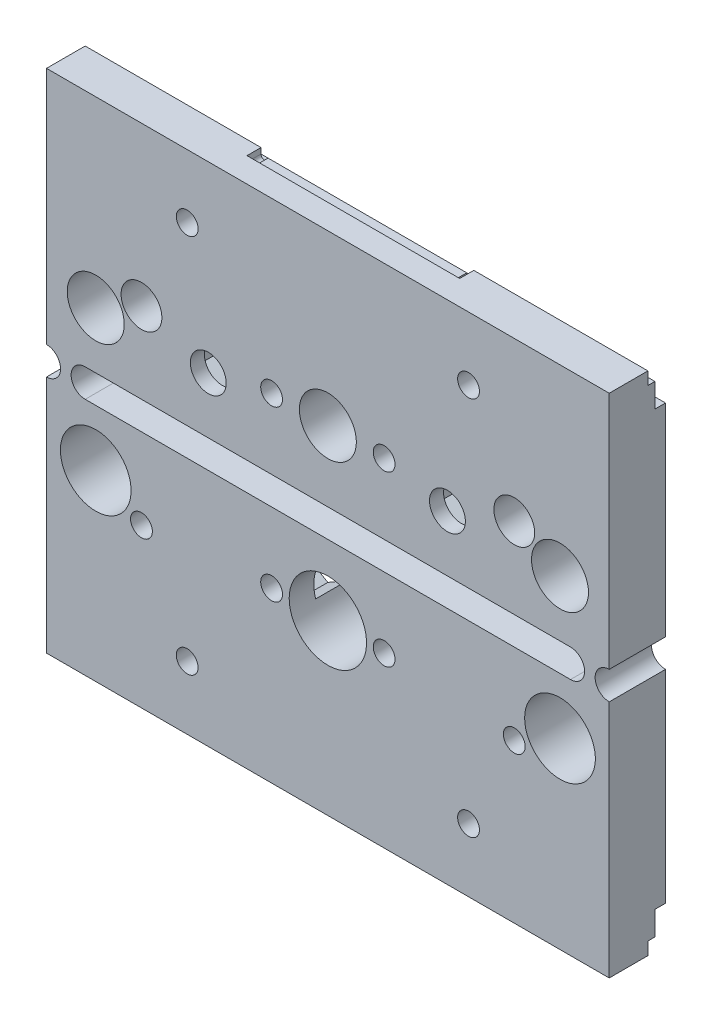
from build123d import *

# Parameters (mm, degrees)
SKETCH_2_W           = 80
SKETCH_2_H           = 34
SKETCH_2_R           = 4.05
EXTRUDE_1_DEPTH      = 8
SKETCH_3_R           = 2.55
CUT_EXTRUDE_1_DEPTH  = 88.292611371
CUT_EXTRUDE_2_DEPTH  = 88.292611371
SKETCH_5_R           = 1.55
CUT_EXTRUDE_3_DEPTH  = 88.292611371
CUT_EXTRUDE_5_DEPTH  = 4.5
SKETCH_25_R          = 1.55
CUT_EXTRUDE_13_DEPTH = 88.292611371
CUT_EXTRUDE_11_DEPTH = 2
EXTRUDE_2_DEPTH      = 8
SKETCH_26_R          = 5.025
CUT_EXTRUDE_14_DEPTH = 89.926936302
SKETCH_27_R          = 2.9
SKETCH_27_R_2        = 1.55
CUT_EXTRUDE_15_DEPTH = 89.926936302
CUT_EXTRUDE_16_DEPTH = 6
SKETCH_29_R          = 5.5
CUT_EXTRUDE_17_DEPTH = 89.926936302


with BuildPart() as part:
    # 草图2 → 凸台-拉伸1 (new body)
    with BuildSketch(Plane.XY):
        with Locations((40, 17)):
            Rectangle(SKETCH_2_W, SKETCH_2_H)
        with Locations((7, 8)):
            Circle(SKETCH_2_R, mode=Mode.SUBTRACT)
        with Locations((40, 10)):
            Circle(SKETCH_2_R, mode=Mode.SUBTRACT)
        with Locations((73, 8)):
            Circle(SKETCH_2_R, mode=Mode.SUBTRACT)
    extrude_1 = extrude(amount=EXTRUDE_1_DEPTH)

    # 草图3 → 切除-拉伸1 (cut, through all)
    with BuildSketch(Plane.XY.offset(8)):
        with Locations((23, 8)):
            Circle(SKETCH_3_R)
        with Locations((57, 8)):
            Circle(SKETCH_3_R)
    extrude(amount=-CUT_EXTRUDE_1_DEPTH, mode=Mode.SUBTRACT)

    # 草图4 → 切除-拉伸2 (cut, through all)
    with BuildSketch(Plane(origin=(80, 0, 0), x_dir=(0, 0, -1), z_dir=(1, 0, 0))):
        Polygon((-1.5, 32.2), (-2.5, 32.2), (-2.5, 34), (0, 34), (0, 28.8), (-1.5, 28.8), align=None)
    cut_extrude_2 = extrude(amount=-CUT_EXTRUDE_2_DEPTH, mode=Mode.SUBTRACT)

    # 草图5 → 切除-拉伸3 (cut, through all)
    with BuildSketch(Plane.XY.offset(8)):
        with Locations((48, 10)):
            Circle(SKETCH_5_R)
        with Locations((32, 10)):
            Circle(SKETCH_5_R)
    cut_extrude_3 = extrude(amount=-CUT_EXTRUDE_3_DEPTH, mode=Mode.SUBTRACT)

    # 草图8 → 切除-拉伸5 (cut)
    with BuildSketch(Plane(origin=(0, 0, 0), x_dir=(-1, 0, 0), z_dir=(0, 0, -1))):
        Polygon((-45.15, 8.354551733), (-45.15, 11.645448267), (-48, 13.290896534), (-50.85, 11.645448267), (-50.85, 8.354551733), (-48, 6.709103466), align=None)
        Polygon((-29.15, 8.354551733), (-29.15, 11.645448267), (-32, 13.290896534), (-34.85, 11.645448267), (-34.85, 8.354551733), (-32, 6.709103466), align=None)
    cut_extrude_5 = extrude(amount=-CUT_EXTRUDE_5_DEPTH, mode=Mode.SUBTRACT)

    # 草图25 → 切除-拉伸13 (cut, through all)
    with BuildSketch(Plane(origin=(0, 0, 0), x_dir=(-1, 0, 0), z_dir=(0, 0, -1))):
        with Locations((-60, 25)):
            Circle(SKETCH_25_R)
        with Locations((-20, 25)):
            Circle(SKETCH_25_R)
    cut_extrude_13 = extrude(amount=-CUT_EXTRUDE_13_DEPTH, mode=Mode.SUBTRACT)

    # 草图19 → 切除-拉伸11 (cut)
    with BuildSketch(Plane(origin=(0, 0, 2.5), x_dir=(-1, 0, 0), z_dir=(0, 0, -1))):
        with BuildLine():
            Line((-25, 34), (-55.247938178, 34))
            Line((-55.247938178, 34), (-55.247938178, 33.2))
            ThreePointArc((-55.247938178, 33.2), (-54.747938178, 32.7), (-54.247938178, 33.2))
            Line((-54.247938178, 33.2), (-26, 33.2))
            ThreePointArc((-26, 33.2), (-25.5, 32.7), (-25, 33.2))
            Line((-25, 33.2), (-25, 34))
        make_face()
    cut_extrude_11 = extrude(amount=-CUT_EXTRUDE_11_DEPTH, mode=Mode.SUBTRACT)

    # 草图22 → 凸台-拉伸2 (add)
    with BuildSketch(Plane.XY.offset(8)):
        with BuildLine():
            Line((0, -4), (5.5, -4))
            ThreePointArc((5.5, -4), (3.5, -2), (5.5, 0))
            Line((5.5, 0), (0, 0))
            ThreePointArc((0, 0), (2, -2), (0, -4))
        make_face()
        with BuildLine():
            Line((80, 0), (74.5, 0))
            ThreePointArc((74.5, 0), (76.5, -2), (74.5, -4))
            Line((74.5, -4), (80, -4))
            ThreePointArc((80, -4), (78, -2), (80, 0))
        make_face()
    extrude(amount=-EXTRUDE_2_DEPTH)

    # 镜向2: 凸台-拉伸1, 切除-拉伸2, 切除-拉伸3, 切除-拉伸5, 切除-拉伸13, 切除-拉伸11 across plane
    add(extrude_1.mirror(Plane(origin=(0, -2, 0), x_dir=(0, 0, 1), z_dir=(0, -1, 0))))
    add(cut_extrude_2.mirror(Plane(origin=(0, -2, 0), x_dir=(0, 0, 1), z_dir=(0, -1, 0))), mode=Mode.SUBTRACT)
    add(cut_extrude_3.mirror(Plane(origin=(0, -2, 0), x_dir=(0, 0, 1), z_dir=(0, -1, 0))), mode=Mode.SUBTRACT)
    add(cut_extrude_5.mirror(Plane(origin=(0, -2, 0), x_dir=(0, 0, 1), z_dir=(0, -1, 0))), mode=Mode.SUBTRACT)
    add(cut_extrude_13.mirror(Plane(origin=(0, -2, 0), x_dir=(0, 0, 1), z_dir=(0, -1, 0))), mode=Mode.SUBTRACT)
    add(cut_extrude_11.mirror(Plane(origin=(0, -2, 0), x_dir=(0, 0, 1), z_dir=(0, -1, 0))), mode=Mode.SUBTRACT)

    # 草图26 → 切除-拉伸14 (cut, through all)
    with BuildSketch(Plane(origin=(0, 0, 0), x_dir=(-1, 0, 0), z_dir=(0, 0, -1))):
        with Locations((-73, -12)):
            Circle(SKETCH_26_R)
        with Locations((-7, -12)):
            Circle(SKETCH_26_R)
    extrude(amount=-CUT_EXTRUDE_14_DEPTH, mode=Mode.SUBTRACT)

    # 草图27 → 切除-拉伸15 (cut, through all)
    with BuildSketch(Plane(origin=(0, 0, 0), x_dir=(-1, 0, 0), z_dir=(0, 0, -1))):
        with Locations((-66.5, 11.5)):
            Circle(SKETCH_27_R)
        with Locations((-66.5, -15.5)):
            Circle(SKETCH_27_R_2)
        with Locations((-13.5, -15.5)):
            Circle(SKETCH_27_R_2)
        with Locations((-13.5, 11.5)):
            Circle(SKETCH_27_R)
    extrude(amount=-CUT_EXTRUDE_15_DEPTH, mode=Mode.SUBTRACT)

    # 草图28 → 切除-拉伸16 (cut)
    with BuildSketch(Plane(origin=(0, 0, 0), x_dir=(-1, 0, 0), z_dir=(0, 0, -1))):
        Polygon((-52.9, 5.632863896), (-52.9, 10.367136104), (-57, 12.734272207), (-61.1, 10.367136104), (-61.1, 5.632863896), (-57, 3.265727793), align=None)
        Polygon((-18.9, 5.632863896), (-18.9, 10.367136104), (-23, 12.734272207), (-27.1, 10.367136104), (-27.1, 5.632863896), (-23, 3.265727793), align=None)
    extrude(amount=-CUT_EXTRUDE_16_DEPTH, mode=Mode.SUBTRACT)

    # 草图29 → 切除-拉伸17 (cut, through all)
    with BuildSketch(Plane(origin=(0, 0, 0), x_dir=(-1, 0, 0), z_dir=(0, 0, -1))):
        with Locations((-40, -14)):
            Circle(SKETCH_29_R)
    extrude(amount=-CUT_EXTRUDE_17_DEPTH, mode=Mode.SUBTRACT)


solid = part.part
